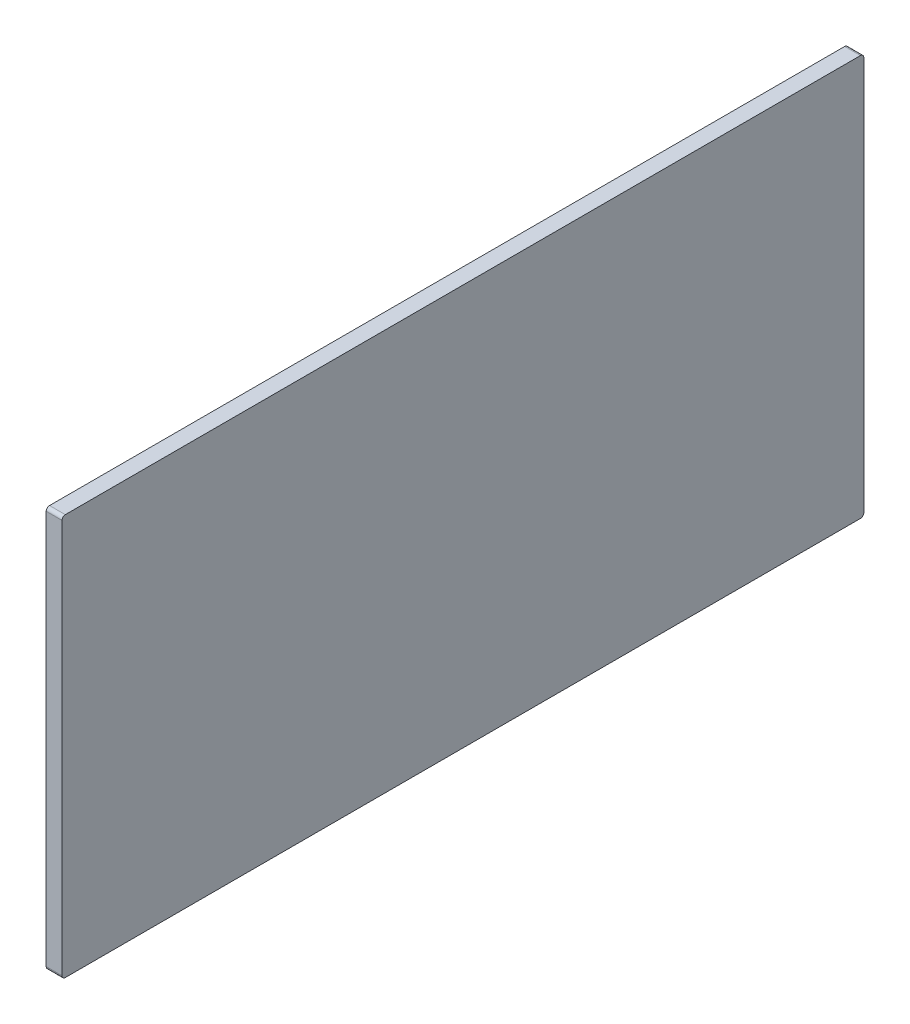
from build123d import *

# Parameters (mm, degrees)
SKETCH1_W           = 609.6
SKETCH1_H           = 304.8
BOSS_EXTRUDE1_DEPTH = 11.9888
FILLET1_R           = 2.54


with BuildPart() as part:
    # Sketch1 → Boss-Extrude1 (new body)
    with BuildSketch(Plane.ZY.offset(311.15)):
        with Locations((0, 330.2)):
            Rectangle(SKETCH1_W, SKETCH1_H)
    extrude(amount=BOSS_EXTRUDE1_DEPTH)

    # Fillet1
    fillet1_edges = [part.edges().sort_by_distance(p)[0] for p in [
        (-317.1444, 482.6, -304.8),
        (-317.1444, 177.8, -304.8),
        (-317.1444, 177.8, 304.8),
        (-317.1444, 482.6, 304.8),
    ]]
    fillet(fillet1_edges, radius=FILLET1_R)


solid = part.part
